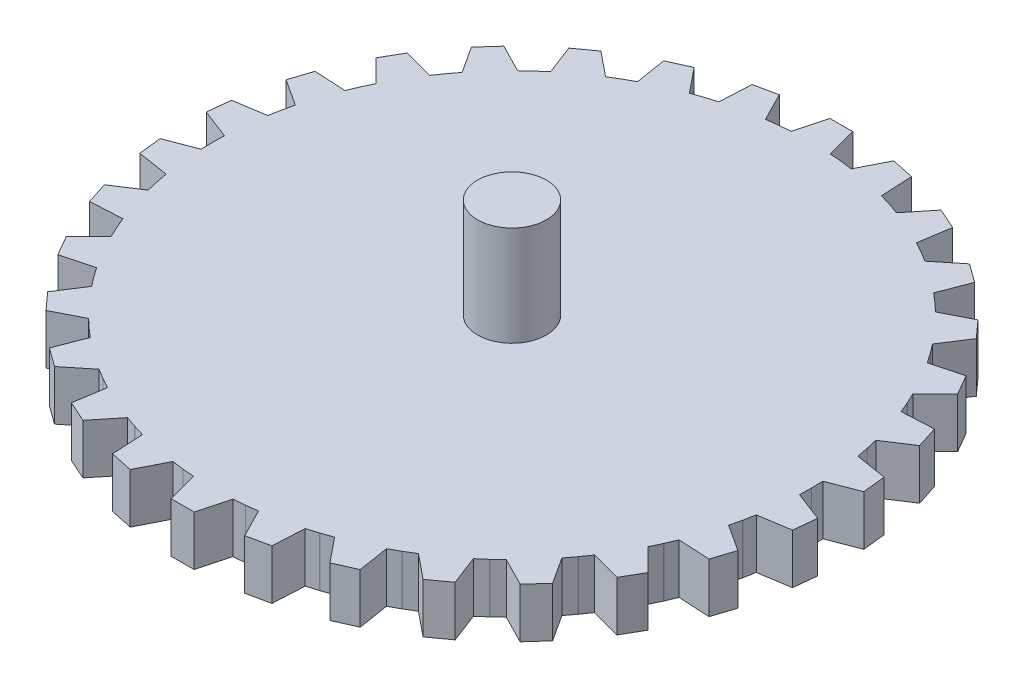
from build123d import *

# Parameters (mm, degrees)
AUFSATZ_LINEAR_AUSTRAGEN1_DEPTH     = 5
AUFSATZ_LINEAR_START                = 5
AUFSATZ_LINEAR_AUSTRAGEN2_OUTLINE_R = 3.45
AUFSATZ_LINEAR_AUSTRAGEN2_DEPTH     = 10


# Read off the part's stored shape, not the designer's step: Aufsatz-Linear austragen2
with BuildPart() as part:
    # Skizze1 → Aufsatz-Linear austragen1 (new body)
    with BuildSketch(Plane(origin=(0, 0, 0), x_dir=(1, 0, 0), z_dir=(0, 1, 0))):
        with BuildLine():
            Line((1.15, 33), (-1.15, 33))
            Line((-1.15, 33), (-1.971219207, 29.935168195))
            Line((-1.971219207, 29.935168195), (-3.121219207, 29.8371914))
            ThreePointArc((-3.121219207, 29.8371914), (-3.135853898, 29.835656861), (-3.150487834, 29.834115144))
            Line((-3.150487834, 29.834115144), (-4.295728096, 29.690852465))
            Line((-4.295728096, 29.690852465), (-5.736216056, 32.517969269))
            Line((-5.736216056, 32.517969269), (-7.985955538, 32.03977238))
            Line((-7.985955538, 32.03977238), (-8.152014772, 28.871173429))
            Line((-8.152014772, 28.871173429), (-9.256513992, 28.536239218))
            ThreePointArc((-9.256513992, 28.536239218), (-9.270509831, 28.531695489), (-9.28450344, 28.527144895))
            Line((-9.28450344, 28.527144895), (-10.374931469, 28.148904011))
            Line((-10.374931469, 28.148904011), (-12.371731945, 30.614747242))
            Line((-12.371731945, 30.614747242), (-14.472886498, 29.679252963))
            Line((-14.472886498, 29.679252963), (-13.976528174, 26.545369845))
            Line((-13.976528174, 26.545369845), (-14.987254698, 25.98811645))
            ThreePointArc((-14.987254698, 25.98811645), (-15, 25.980762114), (-15.012741693, 25.973401526))
            Line((-15.012741693, 25.973401526), (-16.000700551, 25.376713378))
            Line((-16.000700551, 25.376713378), (-18.466543782, 27.373513855))
            Line((-18.466543782, 27.373513855), (-20.327282869, 26.021607774))
            Line((-20.327282869, 26.021607774), (-19.190200228, 23.05940622))
            Line((-19.190200228, 23.05940622), (-20.062980457, 22.304188288))
            ThreePointArc((-20.062980457, 22.304188288), (-20.073918191, 22.294344764), (-20.084851095, 22.284495877))
            Line((-20.084851095, 22.284495877), (-20.92716224, 21.495438599))
            Line((-20.92716224, 21.495438599), (-23.754279043, 22.935926559))
            Line((-23.754279043, 22.935926559), (-25.293279438, 21.226693461))
            Line((-25.293279438, 21.226693461), (-23.565168447, 18.565635892))
            Line((-23.565168447, 18.565635892), (-24.261857697, 17.645460071))
            ThreePointArc((-24.261857697, 17.645460071), (-24.270509831, 17.633557569), (-24.279156127, 17.621650824))
            Line((-24.279156127, 17.621650824), (-24.939006519, 16.674710007))
            Line((-24.939006519, 16.674710007), (-28.003838325, 17.495929214))
            Line((-28.003838325, 17.495929214), (-29.153838325, 15.504070786))
            Line((-29.153838325, 15.504070786), (-26.910225727, 13.260458187))
            Line((-26.910225727, 13.260458187), (-27.400375334, 12.215540576))
            ThreePointArc((-27.400375334, 12.215540576), (-27.406363729, 12.202099292), (-27.412345531, 12.188655073))
            Line((-27.412345531, 12.188655073), (-27.860896543, 11.125216574))
            Line((-27.860896543, 11.125216574), (-31.029495494, 11.291275808))
            Line((-31.029495494, 11.291275808), (-31.740234581, 9.103845821))
            Line((-31.740234581, 9.103845821), (-29.079177012, 7.37573483))
            Line((-29.079177012, 7.37573483), (-29.341365087, 6.251743341))
            ThreePointArc((-29.341365087, 6.251743341), (-29.344428022, 6.237350725), (-29.347483897, 6.222956607))
            Line((-29.347483897, 6.222956607), (-29.565131697, 5.089497791))
            Line((-29.565131697, 5.089497791), (-32.699014814, 4.593139467))
            Line((-32.699014814, 4.593139467), (-32.93943028, 2.305739108))
            Line((-32.93943028, 2.305739108), (-29.977228726, 1.168656467))
            Line((-29.977228726, 1.168656467), (-29.999996391, 0.014714923))
            ThreePointArc((-29.999996391, 0.014714923), (-30, 0), (-29.999996391, -0.014714924))
            Line((-29.999996391, -0.014714924), (-29.977228726, -1.168656467))
            Line((-29.977228726, -1.168656467), (-32.93943028, -2.305739108))
            Line((-32.93943028, -2.305739108), (-32.699014814, -4.593139468))
            Line((-32.699014814, -4.593139468), (-29.565131697, -5.089497791))
            Line((-29.565131697, -5.089497791), (-29.347483897, -6.222956607))
            ThreePointArc((-29.347483897, -6.222956607), (-29.344428022, -6.237350725), (-29.341365087, -6.251743341))
            Line((-29.341365087, -6.251743341), (-29.079177012, -7.37573483))
            Line((-29.079177012, -7.37573483), (-31.740234581, -9.103845821))
            Line((-31.740234581, -9.103845821), (-31.029495494, -11.291275808))
            Line((-31.029495494, -11.291275808), (-27.860896543, -11.125216574))
            Line((-27.860896543, -11.125216574), (-27.412345531, -12.188655073))
            ThreePointArc((-27.412345531, -12.188655073), (-27.406363729, -12.202099292), (-27.400375334, -12.215540576))
            Line((-27.400375334, -12.215540576), (-26.910225727, -13.260458187))
            Line((-26.910225727, -13.260458187), (-29.153838325, -15.504070786))
            Line((-29.153838325, -15.504070786), (-28.003838325, -17.495929214))
            Line((-28.003838325, -17.495929214), (-24.939006519, -16.674710007))
            Line((-24.939006519, -16.674710007), (-24.279156127, -17.621650824))
            ThreePointArc((-24.279156127, -17.621650824), (-24.270509831, -17.633557569), (-24.261857697, -17.645460071))
            Line((-24.261857697, -17.645460071), (-23.565168447, -18.565635892))
            Line((-23.565168447, -18.565635892), (-25.293279438, -21.226693461))
            Line((-25.293279438, -21.226693461), (-23.754279043, -22.935926559))
            Line((-23.754279043, -22.935926559), (-20.92716224, -21.495438599))
            Line((-20.92716224, -21.495438599), (-20.084851095, -22.284495877))
            ThreePointArc((-20.084851095, -22.284495877), (-20.073918191, -22.294344764), (-20.062980457, -22.304188288))
            Line((-20.062980457, -22.304188288), (-19.190200228, -23.05940622))
            Line((-19.190200228, -23.05940622), (-20.327282869, -26.021607774))
            Line((-20.327282869, -26.021607774), (-18.466543782, -27.373513855))
            Line((-18.466543782, -27.373513855), (-16.000700551, -25.376713378))
            Line((-16.000700551, -25.376713378), (-15.012741693, -25.973401526))
            ThreePointArc((-15.012741693, -25.973401526), (-15, -25.980762114), (-14.987254698, -25.98811645))
            Line((-14.987254698, -25.98811645), (-13.976528174, -26.545369845))
            Line((-13.976528174, -26.545369845), (-14.472886498, -29.679252963))
            Line((-14.472886498, -29.679252963), (-12.371731945, -30.614747242))
            Line((-12.371731945, -30.614747242), (-10.374931469, -28.148904011))
            Line((-10.374931469, -28.148904011), (-9.28450344, -28.527144895))
            ThreePointArc((-9.28450344, -28.527144895), (-9.270509831, -28.531695489), (-9.256513992, -28.536239218))
            Line((-9.256513992, -28.536239218), (-8.152014772, -28.871173429))
            Line((-8.152014772, -28.871173429), (-7.985955538, -32.03977238))
            Line((-7.985955538, -32.03977238), (-5.736216056, -32.517969269))
            Line((-5.736216056, -32.517969269), (-4.295728096, -29.690852465))
            Line((-4.295728096, -29.690852465), (-3.150487834, -29.834115144))
            ThreePointArc((-3.150487834, -29.834115144), (-3.135853898, -29.835656861), (-3.121219207, -29.8371914))
            Line((-3.121219207, -29.8371914), (-1.971219207, -29.935168195))
            Line((-1.971219207, -29.935168195), (-1.15, -33))
            Line((-1.15, -33), (1.15, -33))
            Line((1.15, -33), (1.971219207, -29.935168195))
            Line((1.971219207, -29.935168195), (3.121219207, -29.8371914))
            ThreePointArc((3.121219207, -29.8371914), (3.135853898, -29.835656861), (3.150487834, -29.834115144))
            Line((3.150487834, -29.834115144), (4.295728096, -29.690852465))
            Line((4.295728096, -29.690852465), (5.736216056, -32.517969269))
            Line((5.736216056, -32.517969269), (7.985955538, -32.03977238))
            Line((7.985955538, -32.03977238), (8.152014772, -28.871173429))
            Line((8.152014772, -28.871173429), (9.256513992, -28.536239218))
            ThreePointArc((9.256513992, -28.536239218), (9.270509831, -28.531695489), (9.28450344, -28.527144895))
            Line((9.28450344, -28.527144895), (10.374931469, -28.148904011))
            Line((10.374931469, -28.148904011), (12.371731945, -30.614747242))
            Line((12.371731945, -30.614747242), (14.472886498, -29.679252963))
            Line((14.472886498, -29.679252963), (13.976528174, -26.545369845))
            Line((13.976528174, -26.545369845), (14.987254698, -25.98811645))
            ThreePointArc((14.987254698, -25.98811645), (15, -25.980762114), (15.012741693, -25.973401526))
            Line((15.012741693, -25.973401526), (16.000700551, -25.376713378))
            Line((16.000700551, -25.376713378), (18.466543782, -27.373513855))
            Line((18.466543782, -27.373513855), (20.327282869, -26.021607774))
            Line((20.327282869, -26.021607774), (19.190200228, -23.05940622))
            Line((19.190200228, -23.05940622), (20.062980457, -22.304188288))
            ThreePointArc((20.062980457, -22.304188288), (20.073918191, -22.294344764), (20.084851095, -22.284495877))
            Line((20.084851095, -22.284495877), (20.92716224, -21.495438599))
            Line((20.92716224, -21.495438599), (23.754279043, -22.935926559))
            Line((23.754279043, -22.935926559), (25.293279438, -21.226693461))
            Line((25.293279438, -21.226693461), (23.565168447, -18.565635892))
            Line((23.565168447, -18.565635892), (24.261857697, -17.645460071))
            ThreePointArc((24.261857697, -17.645460071), (24.270509831, -17.633557569), (24.279156127, -17.621650824))
            Line((24.279156127, -17.621650824), (24.939006519, -16.674710007))
            Line((24.939006519, -16.674710007), (28.003838325, -17.495929214))
            Line((28.003838325, -17.495929214), (29.153838325, -15.504070786))
            Line((29.153838325, -15.504070786), (26.910225727, -13.260458187))
            Line((26.910225727, -13.260458187), (27.400375334, -12.215540576))
            ThreePointArc((27.400375334, -12.215540576), (27.406363729, -12.202099292), (27.412345531, -12.188655073))
            Line((27.412345531, -12.188655073), (27.860896543, -11.125216574))
            Line((27.860896543, -11.125216574), (31.029495494, -11.291275808))
            Line((31.029495494, -11.291275808), (31.740234581, -9.103845821))
            Line((31.740234581, -9.103845821), (29.079177013, -7.37573483))
            Line((29.079177013, -7.37573483), (29.341365087, -6.251743341))
            ThreePointArc((29.341365087, -6.251743341), (29.344428022, -6.237350725), (29.347483897, -6.222956607))
            Line((29.347483897, -6.222956607), (29.565131697, -5.089497791))
            Line((29.565131697, -5.089497791), (32.699014814, -4.593139467))
            Line((32.699014814, -4.593139467), (32.93943028, -2.305739108))
            Line((32.93943028, -2.305739108), (29.977228726, -1.168656467))
            Line((29.977228726, -1.168656467), (29.999996391, -0.014714923))
            ThreePointArc((29.999996391, -0.014714923), (30, 0), (29.999996391, 0.014714924))
            Line((29.999996391, 0.014714924), (29.977228726, 1.168656467))
            Line((29.977228726, 1.168656467), (32.93943028, 2.305739108))
            Line((32.93943028, 2.305739108), (32.699014814, 4.593139468))
            Line((32.699014814, 4.593139468), (29.565131697, 5.089497791))
            Line((29.565131697, 5.089497791), (29.347483897, 6.222956607))
            ThreePointArc((29.347483897, 6.222956607), (29.344428022, 6.237350725), (29.341365087, 6.251743341))
            Line((29.341365087, 6.251743341), (29.079177013, 7.37573483))
            Line((29.079177013, 7.37573483), (31.740234581, 9.103845821))
            Line((31.740234581, 9.103845821), (31.029495494, 11.291275808))
            Line((31.029495494, 11.291275808), (27.860896543, 11.125216574))
            Line((27.860896543, 11.125216574), (27.412345531, 12.188655073))
            ThreePointArc((27.412345531, 12.188655073), (27.406363729, 12.202099292), (27.400375334, 12.215540576))
            Line((27.400375334, 12.215540576), (26.910225727, 13.260458187))
            Line((26.910225727, 13.260458187), (29.153838325, 15.504070786))
            Line((29.153838325, 15.504070786), (28.003838325, 17.495929214))
            Line((28.003838325, 17.495929214), (24.939006519, 16.674710007))
            Line((24.939006519, 16.674710007), (24.279156127, 17.621650824))
            ThreePointArc((24.279156127, 17.621650824), (24.270509831, 17.633557569), (24.261857697, 17.645460071))
            Line((24.261857697, 17.645460071), (23.565168447, 18.565635892))
            Line((23.565168447, 18.565635892), (25.293279438, 21.226693461))
            Line((25.293279438, 21.226693461), (23.754279043, 22.935926559))
            Line((23.754279043, 22.935926559), (20.92716224, 21.495438599))
            Line((20.92716224, 21.495438599), (20.084851095, 22.284495877))
            ThreePointArc((20.084851095, 22.284495877), (20.073918191, 22.294344764), (20.062980457, 22.304188288))
            Line((20.062980457, 22.304188288), (19.190200228, 23.05940622))
            Line((19.190200228, 23.05940622), (20.327282869, 26.021607774))
            Line((20.327282869, 26.021607774), (18.466543782, 27.373513855))
            Line((18.466543782, 27.373513855), (16.000700551, 25.376713378))
            Line((16.000700551, 25.376713378), (15.012741693, 25.973401526))
            ThreePointArc((15.012741693, 25.973401526), (15, 25.980762114), (14.987254698, 25.98811645))
            Line((14.987254698, 25.98811645), (13.976528174, 26.545369845))
            Line((13.976528174, 26.545369845), (14.472886498, 29.679252963))
            Line((14.472886498, 29.679252963), (12.371731945, 30.614747242))
            Line((12.371731945, 30.614747242), (10.374931469, 28.148904011))
            Line((10.374931469, 28.148904011), (9.28450344, 28.527144895))
            ThreePointArc((9.28450344, 28.527144895), (9.270509831, 28.531695489), (9.256513992, 28.536239218))
            Line((9.256513992, 28.536239218), (8.152014772, 28.871173429))
            Line((8.152014772, 28.871173429), (7.985955538, 32.03977238))
            Line((7.985955538, 32.03977238), (5.736216056, 32.517969269))
            Line((5.736216056, 32.517969269), (4.295728096, 29.690852465))
            Line((4.295728096, 29.690852465), (3.150487834, 29.834115144))
            ThreePointArc((3.150487834, 29.834115144), (3.135853898, 29.835656861), (3.121219207, 29.8371914))
            Line((3.121219207, 29.8371914), (1.971219207, 29.935168195))
            Line((1.971219207, 29.935168195), (1.15, 33))
        make_face()
    extrude(amount=AUFSATZ_LINEAR_AUSTRAGEN1_DEPTH)

    # Aufsatz-Linear austragen2 outline → Aufsatz-Linear austragen2 (add)
    with BuildSketch(Plane(origin=(0, 0, 0), x_dir=(1, 0, 0), z_dir=(0, 1, 0)).offset(AUFSATZ_LINEAR_START)):
        Circle(AUFSATZ_LINEAR_AUSTRAGEN2_OUTLINE_R)
    extrude(amount=AUFSATZ_LINEAR_AUSTRAGEN2_DEPTH)


solid = part.part
